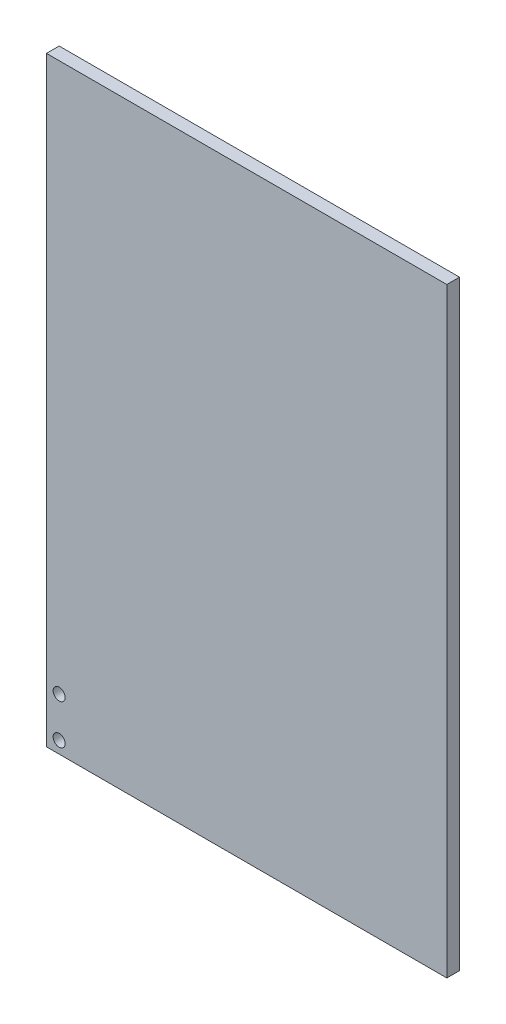
from build123d import *

# Parameters (mm, degrees)
SKETCH1_W           = 100
SKETCH1_H           = 3.175
BOSS_EXTRUDE1_DEPTH = 150
SKETCH2_R           = 1.5
CUT_EXTRUDE2_DEPTH  = 3.175


with BuildPart() as part:
    # Sketch1 → Boss-Extrude1 (new body)
    with BuildSketch(Plane(origin=(0, 0, 0), x_dir=(1, 0, 0), z_dir=(0, 1, 0))):
        with Locations((50, 1.5875)):
            Rectangle(SKETCH1_W, SKETCH1_H)
    extrude(amount=BOSS_EXTRUDE1_DEPTH)

    # Sketch2 → Cut-Extrude2 (cut)
    with BuildSketch(Plane.XY):
        with Locations((3.175, 13)):
            Circle(SKETCH2_R)
        with Locations((3.175, 3)):
            Circle(SKETCH2_R)
    extrude(amount=-CUT_EXTRUDE2_DEPTH, mode=Mode.SUBTRACT)


solid = part.part
